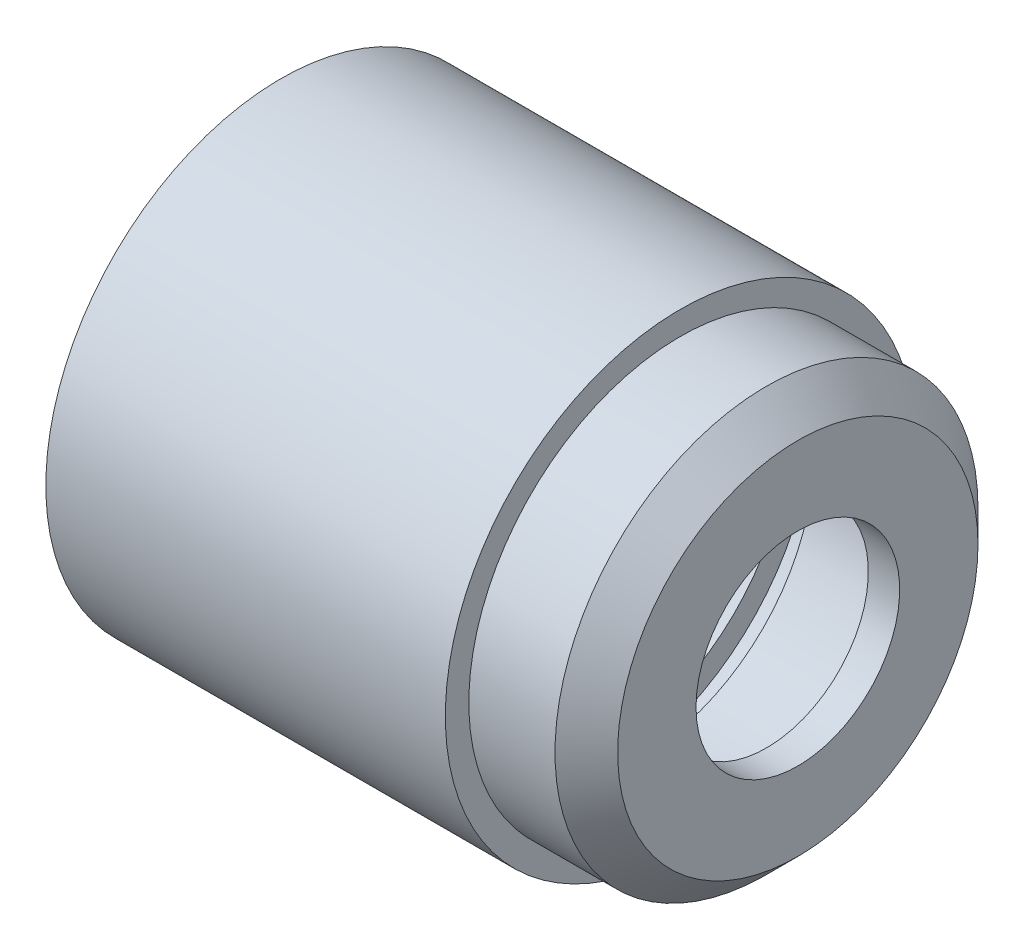
from build123d import *

# Parameters (mm, degrees)
SKETCH1_R           = 15
BOSS_EXTRUDE1_DEPTH = 25.5
SKETCH2_R           = 13.5
BOSS_EXTRUDE2_DEPTH = 7.5
SKETCH3_R           = 14
CUT_EXTRUDE1_DEPTH  = 6.5
SKETCH4_R           = 12
CUT_EXTRUDE2_DEPTH  = 14
SKETCH5_R           = 13.5
CUT_EXTRUDE3_DEPTH  = 2.5
SKETCH6_R           = 11
CUT_EXTRUDE4_DEPTH  = 6
SKETCH7_R           = 11.5
CUT_EXTRUDE5_DEPTH  = 1
SKETCH9_R           = 10
CUT_EXTRUDE6_DEPTH  = 1
SKETCH10_R          = 6.5
CUT_EXTRUDE7_DEPTH  = 2
CHAMFER1_SIZE       = 2


with BuildPart() as part:
    # Sketch1 → Boss-Extrude1 (new body)
    with BuildSketch(Plane(origin=(0, 0, 0), x_dir=(0, 0, -1), z_dir=(1, 0, 0))):
        Circle(SKETCH1_R)
    extrude(amount=BOSS_EXTRUDE1_DEPTH)

    # Sketch2 → Boss-Extrude2 (add)
    with BuildSketch(Plane(origin=(25.5, 0, 0), x_dir=(0, 0, -1), z_dir=(1, 0, 0))):
        Circle(SKETCH2_R)
    extrude(amount=BOSS_EXTRUDE2_DEPTH)

    # Sketch3 → Cut-Extrude1 (cut)
    with BuildSketch(Plane.ZY):
        Circle(SKETCH3_R)
    extrude(amount=-CUT_EXTRUDE1_DEPTH, mode=Mode.SUBTRACT)

    # Sketch4 → Cut-Extrude2 (cut)
    with BuildSketch(Plane.ZY.offset(-6.5)):
        Circle(SKETCH4_R)
    extrude(amount=-CUT_EXTRUDE2_DEPTH, mode=Mode.SUBTRACT)

    # Sketch5 → Cut-Extrude3 (cut)
    with BuildSketch(Plane.ZY.offset(-20.5)):
        Circle(SKETCH5_R)
    extrude(amount=-CUT_EXTRUDE3_DEPTH, mode=Mode.SUBTRACT)

    # Sketch6 → Cut-Extrude4 (cut)
    with BuildSketch(Plane.ZY.offset(-23)):
        Circle(SKETCH6_R)
    extrude(amount=-CUT_EXTRUDE4_DEPTH, mode=Mode.SUBTRACT)

    # Sketch7 → Cut-Extrude5 (cut)
    with BuildSketch(Plane.ZY.offset(-29)):
        Circle(SKETCH7_R)
    extrude(amount=-CUT_EXTRUDE5_DEPTH, mode=Mode.SUBTRACT)

    # Sketch9 → Cut-Extrude6 (cut)
    with BuildSketch(Plane.ZY.offset(-30)):
        Circle(SKETCH9_R)
    extrude(amount=-CUT_EXTRUDE6_DEPTH, mode=Mode.SUBTRACT)

    # Sketch10 → Cut-Extrude7 (cut)
    with BuildSketch(Plane.ZY.offset(-31)):
        Circle(SKETCH10_R)
    extrude(amount=-CUT_EXTRUDE7_DEPTH, mode=Mode.SUBTRACT)

    # Chamfer1
    chamfer1_edges = [part.edges().sort_by_distance(p)[0] for p in [
        (33, 0, 13.5),
    ]]
    chamfer(chamfer1_edges, length=CHAMFER1_SIZE)


solid = part.part
